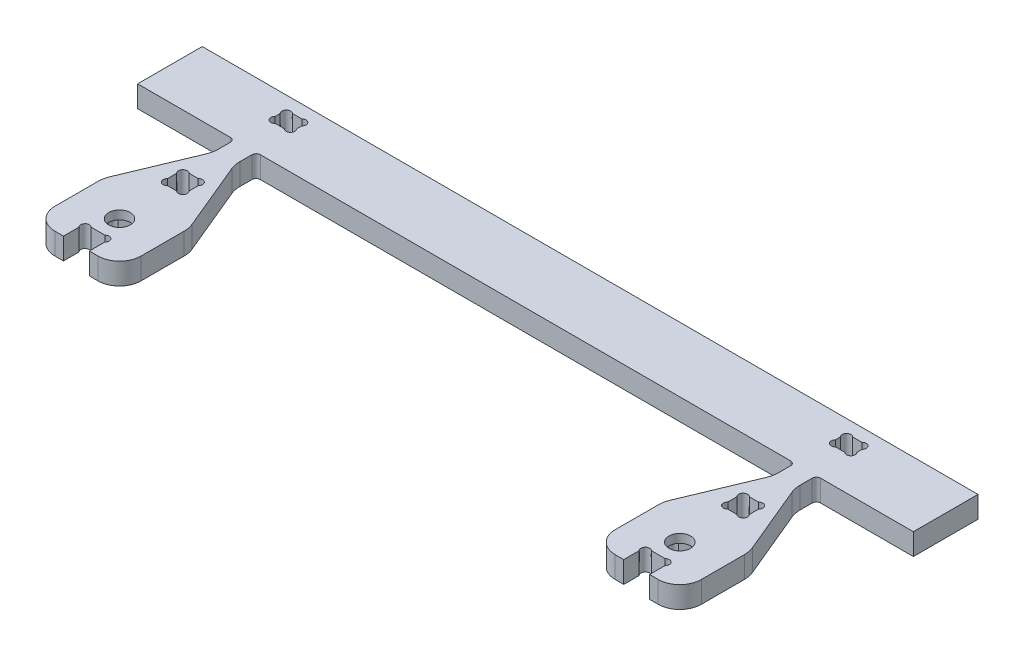
from build123d import *

# Parameters (mm, degrees)
SKETCH_1_R           = 2.5
EXTRUDE_1_DEPTH      = 5
FILLET_1_R           = 5
SKETCH_6_W           = 6
SKETCH_6_H           = 5
CUT_EXTRUDE_5_DEPTH  = 10
SKETCH_7_R           = 1
CUT_EXTRUDE_6_DEPTH  = 10
SKETCH_8_W           = 7.5
SKETCH_8_H           = 5
CUT_EXTRUDE_7_DEPTH  = 10
FILLET_2_R           = 1
CUT_EXTRUDE_9_DEPTH  = 10
FILLET_3_R           = 6
SKETCH_12_W          = 5
SKETCH_12_H          = 4
SKETCH_12_H_2        = 5
CUT_EXTRUDE_10_DEPTH = 5
CUT_EXTRUDE_12_DEPTH = 3
SKETCH_15_R          = 1
CUT_EXTRUDE_13_DEPTH = 3
SKETCH_16_R          = 1
SKETCH_16_R_2        = 1.016973241
CUT_EXTRUDE_14_DEPTH = 10


with BuildPart() as part:
    # 스케치1 → 보스-돌출1 (new body)
    with BuildSketch(Plane(origin=(0, 0, 0), x_dir=(1, 0, 0), z_dir=(0, 1, 0))):
        Polygon((-90, 54.2), (90, 54.2), (90, 39.2), (75, 39.2), (75, 0), (55, 0), (55, 39.2), (-55, 39.2), (-55, 0), (-75, 0), (-75, 39.2), (-90, 39.2), align=None)
        with Locations((65, 10)):
            Circle(SKETCH_1_R, mode=Mode.SUBTRACT)
        with Locations((-65, 10)):
            Circle(SKETCH_1_R, mode=Mode.SUBTRACT)
    extrude(amount=EXTRUDE_1_DEPTH)

    # 필렛1
    fillet_1_edges = [part.edges().sort_by_distance(p)[0] for p in [
        (-75, 2.5, 0),
        (-55, 2.5, 0),
        (55, 2.5, 0),
        (75, 2.5, 0),
    ]]
    fillet(fillet_1_edges, radius=FILLET_1_R)

    # 스케치6 → 컷-돌출5 (cut)
    with BuildSketch(Plane.XZ):
        with Locations((65, -2.5)):
            Rectangle(SKETCH_6_W, SKETCH_6_H)
        with Locations((-65, -2.5)):
            Rectangle(SKETCH_6_W, SKETCH_6_H)
    extrude(amount=-CUT_EXTRUDE_5_DEPTH, mode=Mode.SUBTRACT)

    # 스케치7 → 컷-돌출6 (cut)
    with BuildSketch(Plane.XZ):
        with Locations((62.707106781, -4.292893219)):
            Circle(SKETCH_7_R)
        with Locations((67.292893219, -4.292893219)):
            Circle(SKETCH_7_R)
        with Locations((-67.292893219, -4.292893219)):
            Circle(SKETCH_7_R)
        with Locations((-62.707106781, -4.292893219)):
            Circle(SKETCH_7_R)
    extrude(amount=-CUT_EXTRUDE_6_DEPTH, mode=Mode.SUBTRACT)

    # 스케치8 → 컷-돌출7 (cut)
    with BuildSketch(Plane(origin=(0, 5, 0), x_dir=(1, 0, 0), z_dir=(0, 1, 0))):
        with Locations((71.25, 36.7)):
            Rectangle(SKETCH_8_W, SKETCH_8_H)
        with Locations((58.75, 36.7)):
            Rectangle(SKETCH_8_W, SKETCH_8_H)
        with Locations((-58.75, 36.7)):
            Rectangle(SKETCH_8_W, SKETCH_8_H)
        with Locations((-71.25, 36.7)):
            Rectangle(SKETCH_8_W, SKETCH_8_H)
    extrude(amount=-CUT_EXTRUDE_7_DEPTH, mode=Mode.SUBTRACT)

    # 필렛2
    fillet_2_edges = [part.edges().sort_by_distance(p)[0] for p in [
        (-67.5, 2.5, -39.2),
        (-62.5, 2.5, -39.2),
        (62.5, 2.5, -39.2),
        (67.5, 2.5, -39.2),
    ]]
    fillet(fillet_2_edges, radius=FILLET_2_R)

    # 스케치10 → 컷-돌출9 (cut)
    with BuildSketch(Plane(origin=(0, 5, 0), x_dir=(1, 0, 0), z_dir=(0, 1, 0))):
        Polygon((75, 34.2), (67.5, 34.2), (75, 16.2), align=None)
        Polygon((62.5, 34.2), (55, 34.2), (55, 16.2), align=None)
        Polygon((-75, 16.2), (-75, 34.2), (-67.5, 34.2), align=None)
        Polygon((-55, 16.2), (-55, 34.2), (-62.5, 34.2), align=None)
    extrude(amount=-CUT_EXTRUDE_9_DEPTH, mode=Mode.SUBTRACT)

    # 필렛3
    fillet_3_edges = [part.edges().sort_by_distance(p)[0] for p in [
        (-55, 2.5, -16.2),
        (-75, 2.5, -16.2),
        (55, 2.5, -16.2),
        (75, 2.5, -16.2),
        (-67.5, 2.5, -34.2),
        (-62.5, 2.5, -34.2),
        (62.5, 2.5, -34.2),
        (67.5, 2.5, -34.2),
    ]]
    fillet(fillet_3_edges, radius=FILLET_3_R)

    # 스케치12 → 컷-돌출10 (cut)
    with BuildSketch(Plane(origin=(0, 5, 0), x_dir=(1, 0, 0), z_dir=(0, 1, 0))):
        with Locations((65, 49.2)):
            Rectangle(SKETCH_12_W, SKETCH_12_H)
        with Locations((65, 24.7)):
            Rectangle(SKETCH_12_W, SKETCH_12_H_2)
        with Locations((-65, 24.7)):
            Rectangle(SKETCH_12_W, SKETCH_12_H_2)
        with Locations((-65, 49.2)):
            Rectangle(SKETCH_12_W, SKETCH_12_H)
    extrude(amount=-CUT_EXTRUDE_10_DEPTH, mode=Mode.SUBTRACT)

    # 스케치14 → 컷-돌출12 (cut)
    with BuildSketch(Plane(origin=(0, 0, 0), x_dir=(-1, 0, 0), z_dir=(0, -1, 0))):
        Polygon((-65, 14.618802154), (-69, 12.309401077), (-69, 7.690598923), (-65, 5.381197846), (-61, 7.690598923), (-61, 12.309401077), align=None)
        Polygon((65, 14.618802154), (61, 12.309401077), (61, 7.690598923), (65, 5.381197846), (69, 7.690598923), (69, 12.309401077), align=None)
    extrude(amount=-CUT_EXTRUDE_12_DEPTH, mode=Mode.SUBTRACT)

    # 스케치15 → 컷-돌출13 (cut)
    with BuildSketch(Plane.XZ):
        with Locations((65, -13.618802154)):
            Circle(SKETCH_15_R)
        with Locations((61.866025404, -11.809401077)):
            Circle(SKETCH_15_R)
        with Locations((61.866025404, -8.190598923)):
            Circle(SKETCH_15_R)
        with Locations((65, -6.381197846)):
            Circle(SKETCH_15_R)
        with Locations((68.133974596, -8.190598923)):
            Circle(SKETCH_15_R)
        with Locations((68.133974596, -11.809401077)):
            Circle(SKETCH_15_R)
        with Locations((-68.133974596, -11.809401077)):
            Circle(SKETCH_15_R)
        with Locations((-68.133974596, -8.190598923)):
            Circle(SKETCH_15_R)
        with Locations((-65, -6.381197846)):
            Circle(SKETCH_15_R)
        with Locations((-61.866025404, -8.190598923)):
            Circle(SKETCH_15_R)
        with Locations((-61.866025404, -11.809401077)):
            Circle(SKETCH_15_R)
        with Locations((-65, -13.618802154)):
            Circle(SKETCH_15_R)
    extrude(amount=-CUT_EXTRUDE_13_DEPTH, mode=Mode.SUBTRACT)

    # 스케치16 → 컷-돌출14 (cut)
    with BuildSketch(Plane.XZ):
        with Locations((66.792893219, -47.907106781)):
            Circle(SKETCH_16_R)
        with Locations((66.792893219, -50.492893219)):
            Circle(SKETCH_16_R)
        with Locations((63.207106781, -50.492893219)):
            Circle(SKETCH_16_R)
        with Locations((63.207106781, -47.907106781)):
            Circle(SKETCH_16_R)
        with Locations((66.780891325, -22.919108675)):
            Circle(SKETCH_16_R_2)
        with Locations((63.219108675, -22.919108675)):
            Circle(SKETCH_16_R_2)
        with Locations((63.219108675, -26.480891325)):
            Circle(SKETCH_16_R_2)
        with Locations((66.780891325, -26.480891325)):
            Circle(SKETCH_16_R_2)
        with Locations((-66.780891325, -26.480891325)):
            Circle(SKETCH_16_R_2)
        with Locations((-63.219108675, -26.480891325)):
            Circle(SKETCH_16_R_2)
        with Locations((-63.219108675, -22.919108675)):
            Circle(SKETCH_16_R_2)
        with Locations((-66.780891325, -22.919108675)):
            Circle(SKETCH_16_R_2)
        with Locations((-63.207106781, -47.907106781)):
            Circle(SKETCH_16_R)
        with Locations((-63.207106781, -50.492893219)):
            Circle(SKETCH_16_R)
        with Locations((-66.792893219, -50.492893219)):
            Circle(SKETCH_16_R)
        with Locations((-66.792893219, -47.907106781)):
            Circle(SKETCH_16_R)
    extrude(amount=-CUT_EXTRUDE_14_DEPTH, mode=Mode.SUBTRACT)


solid = part.part
